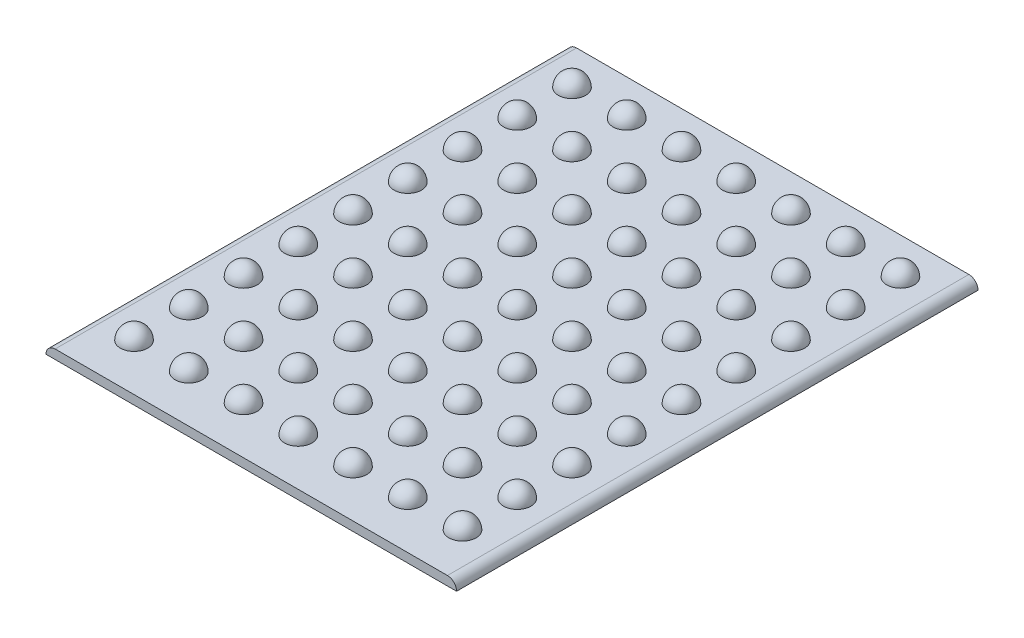
from build123d import *

# Parameters (mm, degrees)
SKETCH1_W            = 90
SKETCH1_H            = 114.3
BOSS_EXTRUDE1_DEPTH  = 2
REVOLVE1_ANGLE       = 180
LPATTERN1_COUNT      = 7
LPATTERN1_PITCH      = 12
LPATTERN1_COUNT_DIR2 = 9
LPATTERN1_PITCH_DIR2 = 12
FILLET1_R            = 2


with BuildPart() as part:
    # Sketch1 → Boss-Extrude1 (new body)
    with BuildSketch(Plane(origin=(0, 0, 0), x_dir=(1, 0, 0), z_dir=(0, 1, 0))):
        with Locations((45, 57.15)):
            Rectangle(SKETCH1_W, SKETCH1_H)
    extrude(amount=BOSS_EXTRUDE1_DEPTH)

    # Sketch2 → Revolve1 (revolve)
    with BuildSketch(Plane(origin=(0, 2, 0), x_dir=(1, 0, 0), z_dir=(0, 1, 0))):
        with BuildLine():
            Line((9, 109.3), (9, 103.3))
            ThreePointArc((9, 103.3), (6, 106.3), (9, 109.3))
        make_face()
    revolve1 = revolve(axis=Axis((9, 2, -110.669010132), (0, 0, -1)), revolution_arc=REVOLVE1_ANGLE)

    # LPattern1: Revolve1 7 × 9
    with Locations(*[(i * LPATTERN1_PITCH, 0, j * LPATTERN1_PITCH_DIR2) for i in range(LPATTERN1_COUNT) for j in range(LPATTERN1_COUNT_DIR2) if (i, j) != (0, 0)]):
        add(revolve1)

    # Fillet1
    fillet1_edges = [part.edges().sort_by_distance(p)[0] for p in [
        (0, 2, -57.15),
        (90, 2, -57.15),
    ]]
    fillet(fillet1_edges, radius=FILLET1_R - 0.0001)  # a hair under: the kernel refuses the full size


solid = part.part
